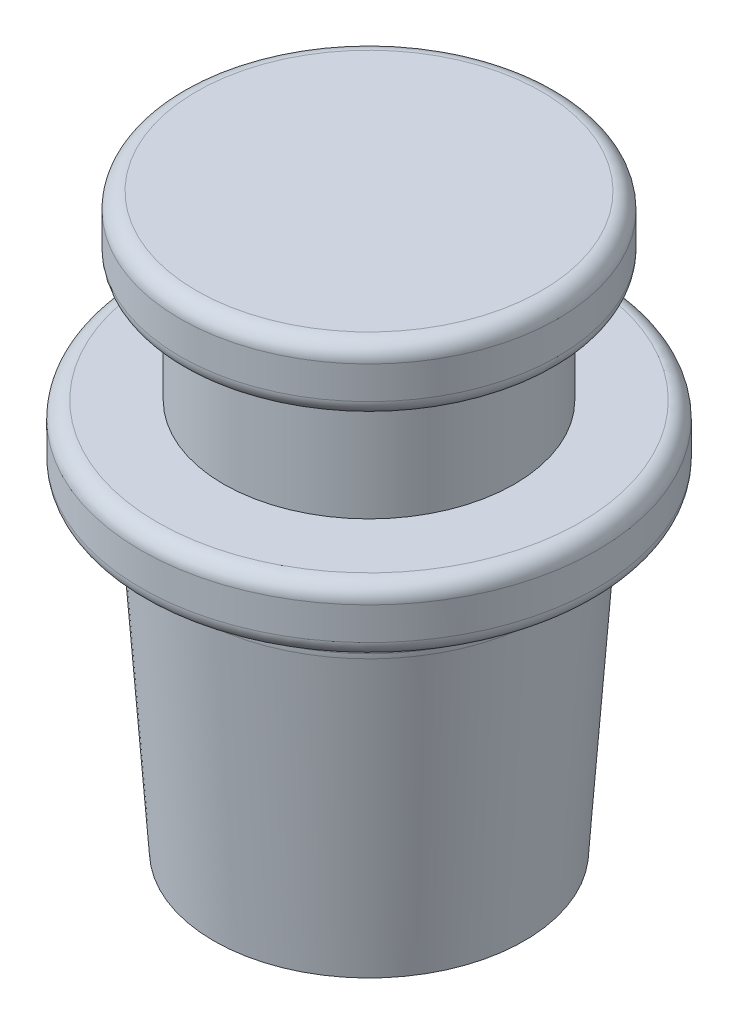
from build123d import *

# Parameters (mm, degrees)
FILLET2_R      = 0.25
FILLET3_R      = 0.25
FILLET4_R      = 0.25
CHAMFER1_SIZE  = 4.5
CHAMFER1_SIZE2 = 0.3146706537458017
FILLET6_R      = 1
FILLET8_R      = 0.25


with BuildPart() as part:
    # Sketch1 → Revolve1 (revolve)
    with BuildSketch(Plane.XY, mode=Mode.PRIVATE) as revolve1_sk:
        Polygon((0, 17.945298939448026), (2.9, 17.945298939448026), (2.9, 16.945298939448023), (2.235, 16.945298939448023), (2.2350000000000003, 15.165298939448023), (3.5, 15.165298939448023), (3.5000000000000004, 14.165298939448023), (2.7, 14.165298939448023), (2.7000000000000006, 9.165298939448022), (0, 9.165298939448022), align=None)
    revolve(revolve1_sk.sketch.rotate(Axis((0, -16.038041176324008, 0), (0, 1, 0)), 90), axis=Axis((0, -16.038041176324008, 0), (0, 1, 0)))

    # Fillet2
    fillet2_edges = [part.edges().sort_by_distance(p)[0] for p in [
        (-8.2e-16, 14.165298939448022, 3.5000000000000004),
        (-8.2e-16, 15.165298939448022, 3.5),
    ]]
    fillet(fillet2_edges, radius=FILLET2_R)

    # Fillet3
    fillet3_edges = [part.edges().sort_by_distance(p)[0] for p in [
        (-6.8e-16, 16.945298939448023, 2.9),
        (-6.8e-16, 17.94529893944803, 2.9),
    ]]
    fillet(fillet3_edges, radius=FILLET3_R)

    # Fillet4
    fillet4_edges = [part.edges().sort_by_distance(p)[0] for p in [
        (-6.3e-16, 14.165298939448022, 2.7),
    ]]
    fillet(fillet4_edges, radius=FILLET4_R)

    # Chamfer1
    chamfer1_edges = [part.edges().sort_by_distance(p)[0] for p in [
        (-6.3e-16, 9.165298939448022, 2.7000000000000006),
    ]]
    chamfer1_side = [part.faces().sort_by_distance(p)[0] for p in [
        (-6.3e-16, 11.540298939448022, 2.7),
    ]]
    chamfer(chamfer1_edges, length=CHAMFER1_SIZE, length2=CHAMFER1_SIZE2, reference=chamfer1_side[0])

    # Fillet6
    # the kernel refuses this fillet: 1 mm, written as the material it takes off along each edge
    with BuildSketch(Plane(origin=(0, 13.665298939448022, 0), x_dir=(1.1e-16, 0, -1), z_dir=(1, 0, 1.1e-16))) as fillet6_piece_1:
        with BuildLine():
            CenterArc((2.7 - FILLET6_R, FILLET6_R * 0.0349207694917), FILLET6_R, 355.99999999999994, 4.000000000000057)
            Line((2.7 - FILLET6_R * 0.00243594974018, -FILLET6_R * 0.0348357042524), (2.7, 0))
            Line((2.7, 0), (2.7, FILLET6_R * 0.0349207694917))
        make_face()
    revolve(axis=Axis((0, 13.665298939448022, 0), (0, 1, 0)), mode=Mode.SUBTRACT)

    # Fillet8
    fillet8_edges = [part.edges().sort_by_distance(p)[0] for p in [
        (-5.2e-16, 16.945298939448023, 2.235),
    ]]
    fillet(fillet8_edges, radius=FILLET8_R)


solid = part.part
